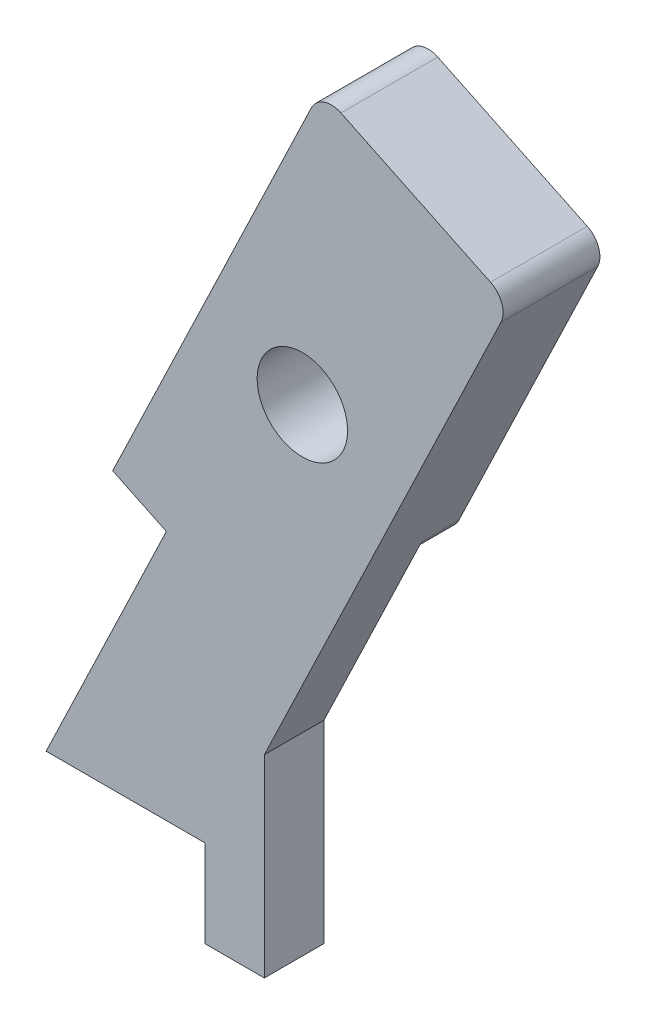
from build123d import *
from build123d.topology import SkipClean

# Parameters (mm, degrees)
SKETCH1_R           = 7.239
BOSS_EXTRUDE1_DEPTH = 9.525
BOSS_EXTRUDE2_START = 5.969
SKETCH2_R           = 7.239
BOSS_EXTRUDE2_DEPTH = 5.969


with BuildPart() as part:
    # Sketch1 → Boss-Extrude1 (new body)
    with BuildSketch(Plane.XY):
        with BuildLine():
            Line((-126.50005572, -28.591685607), (-101.10005572, -28.591685607))
            Line((-101.10005572, -28.591685607), (-101.10005572, -42.561685607))
            Line((-101.10005572, -42.561685607), (-91.57505572, -42.561685607))
            Line((-91.57505572, -42.561685607), (-91.57505572, -11.604423583))
            Line((-91.57505572, -11.604423583), (-53.72433778, 67.21951868))
            ThreePointArc((-53.72433778, 67.21951868), (-53.574782922, 69.937051111), (-55.390617277, 71.964387976))
            Line((-55.390617277, 71.964387976), (-79.31794045, 83.454124907))
            ThreePointArc((-79.31794045, 83.454124907), (-82.035472882, 83.603679766), (-84.062809747, 81.787845411))
            Line((-84.062809747, 81.787845411), (-115.845229462, 15.601105687))
            Line((-115.845229462, 15.601105687), (-107.258869471, 11.477994348))
            Line((-107.258869471, 11.477994348), (-126.50005572, -28.591685607))
        make_face()
        with Locations((-85.495968755, 39.929272483)):
            Circle(SKETCH1_R, mode=Mode.SUBTRACT)
    extrude(amount=BOSS_EXTRUDE1_DEPTH)

    # Sketch2 → Boss-Extrude2 (add)
    with SkipClean():  # the faces are left unmerged after this step: merging them gives an invalid solid
        with BuildSketch(Plane(origin=(0, 0, 0), x_dir=(-1, 0, 0), z_dir=(0, 0, -1)).offset(BOSS_EXTRUDE2_START)):
            with BuildLine():
                Line((106.272636159, 35.535986262), (84.062809747, 81.787845411))
                ThreePointArc((84.062809747, 81.787845411), (82.035472882, 83.603679766), (79.31794045, 83.454124907))
                Line((79.31794045, 83.454124907), (55.390617277, 71.964387976))
                ThreePointArc((55.390617277, 71.964387976), (53.574782922, 69.937051111), (53.72433778, 67.21951868))
                Line((53.72433778, 67.21951868), (75.934164193, 20.967659531))
                ThreePointArc((75.934164193, 20.967659531), (77.961501058, 19.151825175), (80.679033489, 19.301380034))
                Line((80.679033489, 19.301380034), (104.606356663, 30.791116965))
                ThreePointArc((104.606356663, 30.791116965), (106.422191018, 32.818453831), (106.272636159, 35.535986262))
            make_face()
            with Locations((85.495968755, 39.929272483)):
                Circle(SKETCH2_R, mode=Mode.SUBTRACT)
        extrude(amount=-BOSS_EXTRUDE2_DEPTH)


solid = part.part
